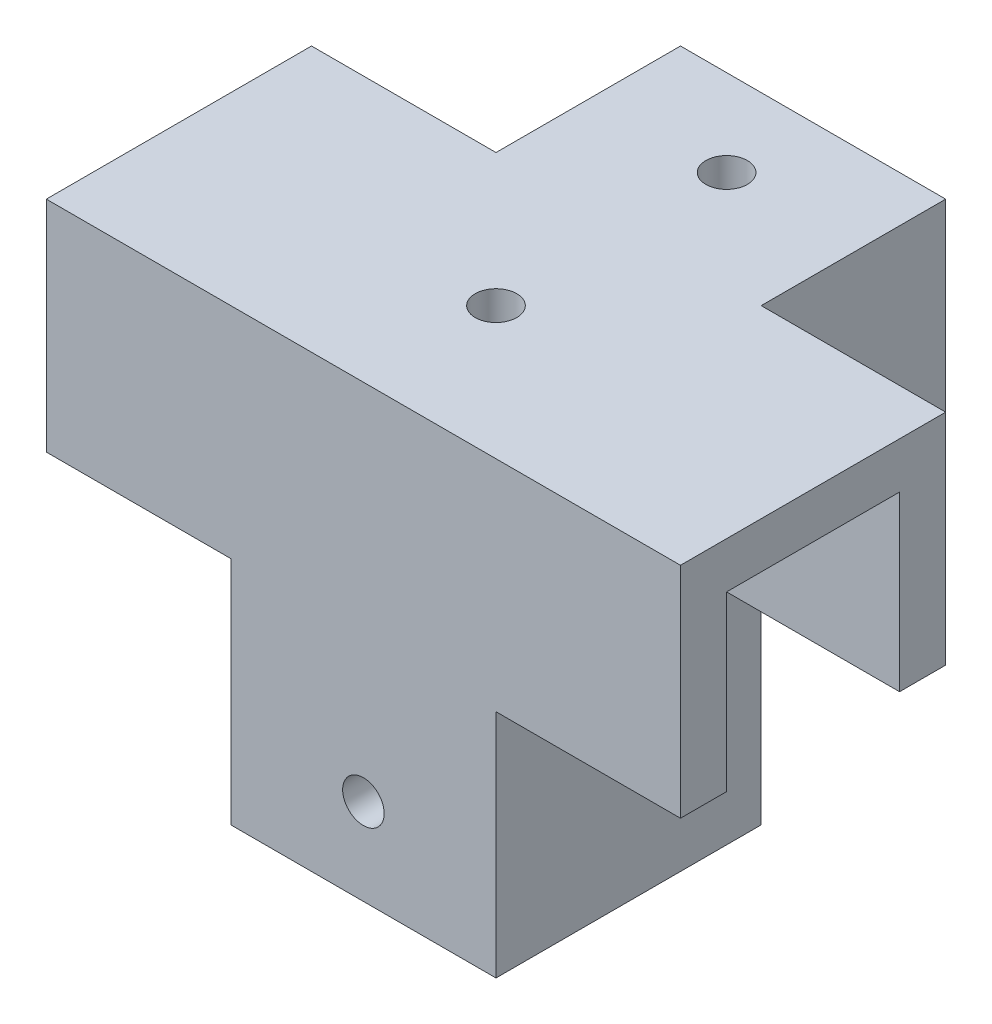
from build123d import *

# Parameters (mm, degrees)
SKETCH_1_W          = 55
SKETCH_1_H          = 4
EXTRUDE_1_DEPTH     = 15
EXTRUDE_1_2_DEPTH   = 15
EXTRUDE_1_3_DEPTH   = 15
EXTRUDE_2_DEPTH     = 4
SKETCH_3_W          = 23
SKETCH_3_H          = 23
SKETCH_3_W_2        = 15
SKETCH_3_H_2        = 15
EXTRUDE_3_DEPTH     = 20
SKETCH_4_R          = 1.8
CUT_EXTRUDE_1_DEPTH = 20
SKETCH_5_R          = 1.8
CUT_EXTRUDE_2_DEPTH = 27


with BuildPart() as part:
    # 草图1 → 凸台-拉伸1 (new body)
    with BuildSketch(Plane(origin=(0, 0, 0), x_dir=(1, 0, 0), z_dir=(0, 1, 0))):
        with Locations((5.469230769, -11.615384615)):
            Rectangle(SKETCH_1_W, SKETCH_1_H)
    extrude(amount=EXTRUDE_1_DEPTH)



with BuildPart() as body_2:
    # 草图1 → Extrude 1 2 (new body)
    with BuildSketch(Plane(origin=(0, 0, 0), x_dir=(1, 0, 0), z_dir=(0, 1, 0))):
        Polygon((-6.030769231, 9.384615385), (-22.030769231, 9.384615385), (-22.030769231, 5.384615385), (-2.030769231, 5.384615385), (-2.030769231, 25.384615385), (-6.030769231, 25.384615385), align=None)
    extrude(amount=EXTRUDE_1_2_DEPTH)


with BuildPart() as body_3:
    # 草图1 → Extrude 1 3 (new body)
    with BuildSketch(Plane(origin=(0, 0, 0), x_dir=(1, 0, 0), z_dir=(0, 1, 0))):
        Polygon((12.969230769, 5.384615385), (32.969230769, 5.384615385), (32.969230769, 9.384615385), (16.969230769, 9.384615385), (16.969230769, 25.384615385), (12.969230769, 25.384615385), align=None)
    extrude(amount=EXTRUDE_1_3_DEPTH)


with BuildPart() as part_1:
    add(part.part)

    add(body_2.part)  # 凸台-拉伸2 merges body 2

    add(body_3.part)  # 凸台-拉伸2 merges body 3
    # 草图2 → 凸台-拉伸2 (add)
    with BuildSketch(Plane(origin=(0, 15, 0), x_dir=(1, 0, 0), z_dir=(0, 1, 0))):
        Polygon((-6.030769231, 9.384615385), (-22.030769231, 9.384615385), (-22.030769231, -13.615384615), (32.969230769, -13.615384615), (32.969230769, 9.384615385), (16.969230769, 9.384615385), (16.969230769, 25.384615385), (-6.030769231, 25.384615385), align=None)
    extrude(amount=EXTRUDE_2_DEPTH)

    # 草图3 → 凸台-拉伸3 (add)
    with BuildSketch(Plane.XZ):
        with Locations((5.469230769, 2.115384615)):
            Rectangle(SKETCH_3_W, SKETCH_3_H)
        with Locations((5.469230769, 2.115384615)):
            Rectangle(SKETCH_3_W_2, SKETCH_3_H_2, mode=Mode.SUBTRACT)
    extrude(amount=EXTRUDE_3_DEPTH)

    # 草图4 → 切除-拉伸1 (cut)
    with BuildSketch(Plane(origin=(0, 19, 0), x_dir=(1, 0, 0), z_dir=(0, 1, 0))):
        with Locations((5.469230769, 17.884615385)):
            Circle(SKETCH_4_R)
        with Locations((5.469230769, -2.115384615)):
            Circle(SKETCH_4_R)
    extrude(amount=-CUT_EXTRUDE_1_DEPTH, mode=Mode.SUBTRACT)

    # 草图5 → 切除-拉伸2 (cut)
    with BuildSketch(Plane.XY.offset(13.615384615)):
        with Locations((5.469230769, -12.5)):
            Circle(SKETCH_5_R)
    extrude(amount=-CUT_EXTRUDE_2_DEPTH, mode=Mode.SUBTRACT)


solid = part_1.part
